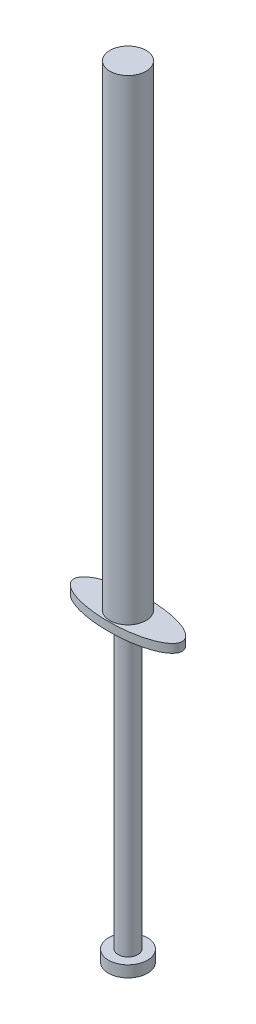
from build123d import *

# Parameters (mm, degrees)
SKETCH1_R           = 3.175
BOSS_EXTRUDE1_DEPTH = 85
SKETCH2_RX          = 9.525
SKETCH2_RY          = 3.455670863
BOSS_EXTRUDE2_DEPTH = 1.5
SKETCH3_R           = 1.733182657
BOSS_EXTRUDE3_DEPTH = 50
SKETCH4_R           = 3.41584424
BOSS_EXTRUDE4_DEPTH = 2


with BuildPart() as part:
    # Sketch1 → Boss-Extrude1 (new body)
    with BuildSketch(Plane(origin=(0, 0, 0), x_dir=(1, 0, 0), z_dir=(0, 1, 0))):
        Circle(SKETCH1_R)
    extrude(amount=BOSS_EXTRUDE1_DEPTH)

    # Sketch2 → Boss-Extrude2 (add)
    with BuildSketch(Plane(origin=(0, 0, 0), x_dir=(1, 0, 0), z_dir=(0, 1, 0))):
        with Locations((0, 0)):
            Ellipse(SKETCH2_RX, SKETCH2_RY)
    extrude(amount=BOSS_EXTRUDE2_DEPTH)

    # Sketch3 → Boss-Extrude3 (add)
    with BuildSketch(Plane(origin=(0, 0, 0), x_dir=(1, 0, 0), z_dir=(0, 1, 0))):
        Circle(SKETCH3_R)
    extrude(amount=-BOSS_EXTRUDE3_DEPTH)

    # Sketch4 → Boss-Extrude4 (add)
    with BuildSketch(Plane.XZ.offset(50)):
        Circle(SKETCH4_R)
    extrude(amount=BOSS_EXTRUDE4_DEPTH)


solid = part.part
